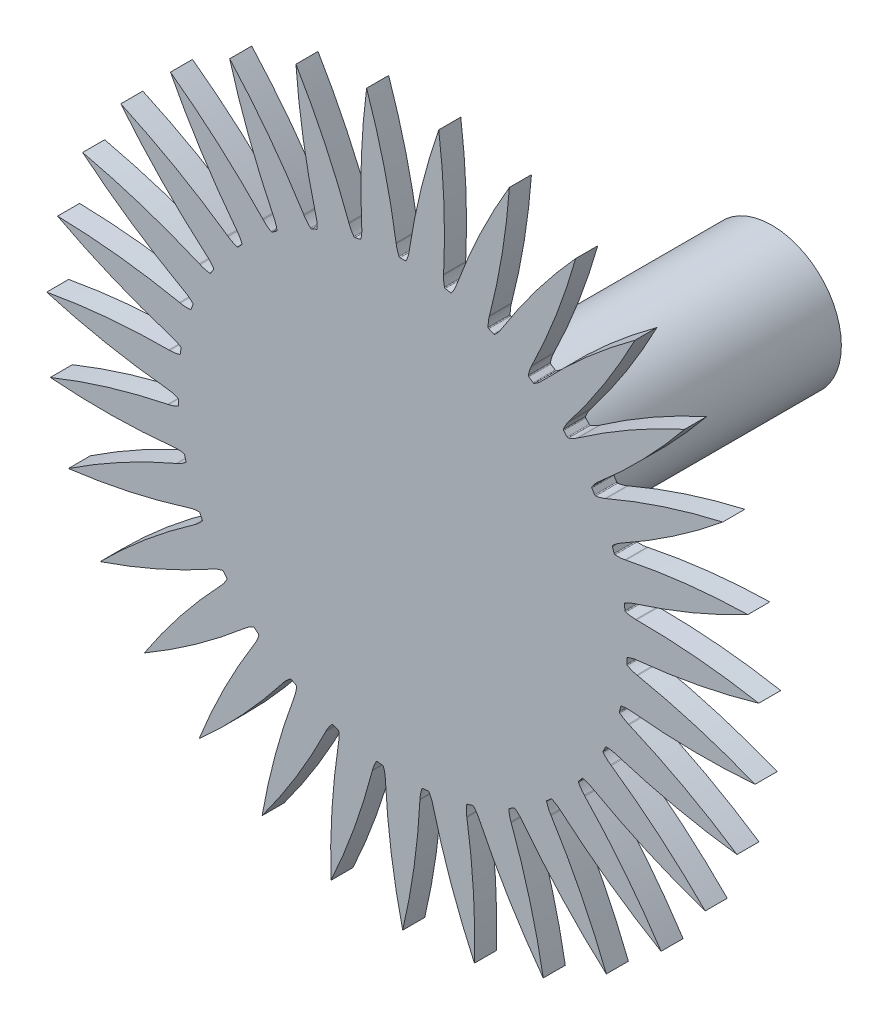
from build123d import *

# Parameters (mm, degrees)
SKETCH1_R                = 500
EXTRUDE1_DEPTH           = 12.7
CUT_EXTRUDE1_DEPTH       = 708.220821243
FILLET1_R                = 0.635
CIRPATTERN1_COUNT        = 31
FILLET1_OF_CIRPATTERN1_R = 0.635
SKETCH3_R                = 40
EXTRUDE2_DEPTH           = 200


with BuildPart() as part:
    # Sketch1 → Extrude1 (new body)
    with BuildSketch(Plane.XY):
        Circle(SKETCH1_R)
    extrude(amount=EXTRUDE1_DEPTH)

    # Sketch2 → Cut-Extrude1 (cut, symmetric)
    with BuildSketch(Plane.XY.offset(12.7)):
        with BuildLine():
            Line((-2460.940364062, 1353.146977655), (-241.231460808, 437.958196997))
            ThreePointArc((-241.231460808, 437.958196997), (-82.810970136, 318.022108626), (-3.81, 135.702159428))
            Line((-3.81, 135.702159428), (-3.732214889, 135.194159428))
            ThreePointArc((-3.732214889, 135.194159428), (-3.039845854, 132.203962215), (-1.905, 129.352159428))
            ThreePointArc((-1.905, 129.352159428), (0, 129.366186361), (1.905, 129.352159428))
            ThreePointArc((1.905, 129.352159428), (3.039845854, 132.203962215), (3.732214889, 135.194159428))
            Line((3.732214889, 135.194159428), (3.81, 135.702159428))
            ThreePointArc((3.81, 135.702159428), (82.810970136, 318.022108626), (241.231460808, 437.958196997))
            Line((241.231460808, 437.958196997), (2460.940364062, 1353.146977655))
            Line((2460.940364062, 1353.146977655), (2460.940364062, 6155.095798468))
            Line((2460.940364062, 6155.095798468), (-2460.940364062, 6155.095798468))
            Line((-2460.940364062, 6155.095798468), (-2460.940364062, 1353.146977655))
        make_face()
    cut_extrude1 = extrude(amount=CUT_EXTRUDE1_DEPTH, both=True, mode=Mode.SUBTRACT)

    # Fillet1
    fillet1_edges = [part.edges().sort_by_distance(p)[0] for p in [
        (1.905, 129.352159428, 6.35),
        (-1.905, 129.352159428, 6.35),
    ]]
    fillet(fillet1_edges, radius=FILLET1_R)

    # CirPattern1: Cut-Extrude1 ×31 about axis
    cirpattern1_axis = Axis((0, 0, 12.7), (0, 0, -1))
    for i in range(1, CIRPATTERN1_COUNT):
        add(cut_extrude1.rotate(cirpattern1_axis, i * 360 / CIRPATTERN1_COUNT), mode=Mode.SUBTRACT)

    # Fillet1 of CirPattern1
    fillet1_of_cirpattern1_edges = [part.edges().sort_by_distance(p)[0] for p in [
        (27.904402801, 126.320839444, 6.35),
        (24.172393725, 127.087786806, 6.35),
        (52.761396073, 118.117929452, 6.35),
        (49.260166811, 119.62042526, 6.35),
        (75.45833159, 105.07925755, 6.35),
        (72.331222879, 107.255789449, 6.35),
        (95.065994147, 87.738628497, 6.35),
        (92.441030185, 90.500089016, 6.35),
        (110.781643733, 66.805969685, 6.35),
        (108.766290853, 70.039304306, 6.35),
        (121.961879808, 43.138266624, 6.35),
        (120.638646795, 46.711102248, 6.35),
        (128.148982194, 17.70447786, 6.35),
        (127.572042362, 21.470542175, 6.35),
        (129.089650192, -8.454134309, 6.35),
        (129.282623525, -4.649024416, 6.35),
        (124.745372744, -34.266633225, 6.35),
        (125.700358892, -30.578259402, 6.35),
        (115.294005079, -58.676252151, 6.35),
        (116.971906796, -55.255616855, 6.35),
        (101.122487299, -80.68365842, 6.35),
        (103.454611093, -77.670802862, 6.35),
        (82.811003008, -99.387866233, 6.35),
        (85.701871456, -96.906137074, 6.35),
        (61.109226524, -114.023123125, 6.35),
        (64.440487132, -112.174122648, 6.35),
        (36.905631126, -123.990259959, 6.35),
        (40.540901693, -122.849686461, 6.35),
        (11.191114854, -128.881220983, 6.35),
        (14.981566976, -128.495769676, 6.35),
        (-14.981566976, -128.495769676, 6.35),
        (-11.191114854, -128.881220983, 6.35),
        (-40.540901693, -122.849686461, 6.35),
        (-36.905631126, -123.990259959, 6.35),
        (-64.440487132, -112.174122648, 6.35),
        (-61.109226524, -114.023123125, 6.35),
        (-85.701871456, -96.906137074, 6.35),
        (-82.811003008, -99.387866233, 6.35),
        (-103.454611093, -77.670802862, 6.35),
        (-101.122487299, -80.68365842, 6.35),
        (-116.971906796, -55.255616855, 6.35),
        (-115.294005079, -58.676252151, 6.35),
        (-125.700358892, -30.578259402, 6.35),
        (-124.745372744, -34.266633225, 6.35),
        (-129.282623525, -4.649024416, 6.35),
        (-129.089650192, -8.454134309, 6.35),
        (-127.572042362, 21.470542175, 6.35),
        (-128.148982194, 17.70447786, 6.35),
        (-120.638646795, 46.711102248, 6.35),
        (-121.961879808, 43.138266624, 6.35),
        (-108.766290853, 70.039304306, 6.35),
        (-110.781643733, 66.805969685, 6.35),
        (-92.441030185, 90.500089016, 6.35),
        (-95.065994147, 87.738628497, 6.35),
        (-72.331222879, 107.255789449, 6.35),
        (-75.45833159, 105.07925755, 6.35),
        (-49.260166811, 119.62042526, 6.35),
        (-52.761396073, 118.117929452, 6.35),
        (-24.172393725, 127.087786806, 6.35),
        (-27.904402801, 126.320839444, 6.35),
    ]]
    fillet(fillet1_of_cirpattern1_edges, radius=FILLET1_OF_CIRPATTERN1_R)

    # Sketch3 → Extrude2 (add)
    with BuildSketch(Plane(origin=(0, 0, 0), x_dir=(-1, 0, 0), z_dir=(0, 0, -1))):
        Circle(SKETCH3_R)
    extrude(amount=EXTRUDE2_DEPTH)


solid = part.part
